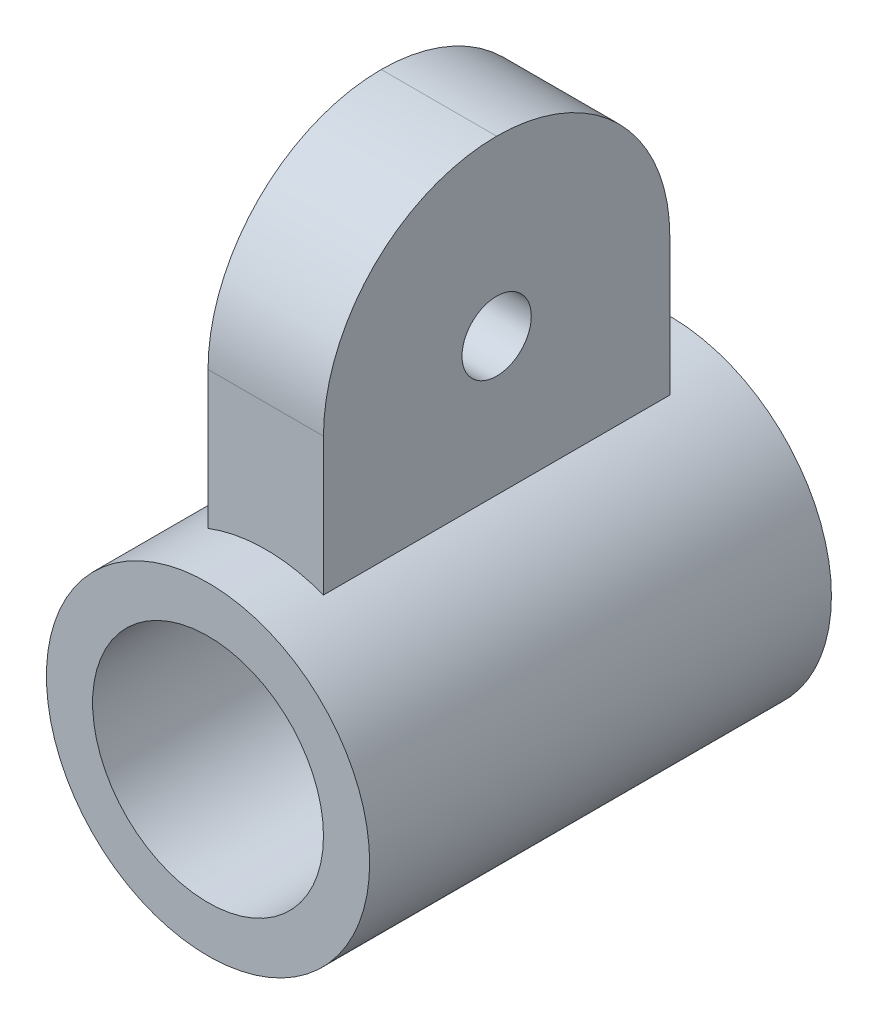
from build123d import *

# Parameters (mm, degrees)
SKETCH1_R                = 14
SKETCH1_R_2              = 10
BOSS_EXTRUDE1_DEPTH      = 20
BOSS_EXTRUDE2_REACH      = 61.262
BOSS_EXTRUDE2_END_RADIUS = 14
SKETCH4_W                = 10
SKETCH4_H                = 30
FILLET1_R                = 15
CUT_EXTRUDE1_REACH       = 50.59
SKETCH5_R                = 3


with BuildPart() as part:
    # Sketch1 → Boss-Extrude1 (new, symmetric)
    with BuildSketch(Plane.XY):
        Circle(SKETCH1_R)
        Circle(SKETCH1_R_2, mode=Mode.SUBTRACT)
    extrude(amount=BOSS_EXTRUDE1_DEPTH, both=True)

    # Boss-Extrude2: up to this cylinder (the profile starts outside it)
    boss_extrude2_end = Plane(origin=(0, 0, 0), z_dir=(0, 0, -1)) * Cylinder(BOSS_EXTRUDE2_END_RADIUS, 151.524, mode=Mode.PRIVATE)
    # Sketch4 → Boss-Extrude2 (add, up to the surface)
    with BuildSketch(Plane(origin=(0, 40, 0), x_dir=(1, 0, 0), z_dir=(0, 1, 0)), mode=Mode.PRIVATE) as boss_extrude2_sk1:
        Rectangle(SKETCH4_W, SKETCH4_H)
    boss_extrude2_tool1 = extrude(boss_extrude2_sk1.sketch, amount=-BOSS_EXTRUDE2_REACH, mode=Mode.PRIVATE) - boss_extrude2_end
    add(boss_extrude2_tool1.solids().sort_by_distance((0, 40, 0))[0])

    # Fillet1
    fillet1_edges = [part.edges().sort_by_distance(p)[0] for p in [
        (0, 40, 15),
        (0, 40, -15),
    ]]
    fillet(fillet1_edges, radius=FILLET1_R - 0.0001)  # a hair under: the kernel refuses the full size

    # Sketch5 → Cut-Extrude1 (cut, up to next)
    with BuildSketch(Plane.ZY.offset(5), mode=Mode.PRIVATE) as cut_extrude1_sk1:
        with Locations((0, 25)):
            Circle(SKETCH5_R)
    cut_extrude1_tool1 = extrude(cut_extrude1_sk1.sketch, amount=-CUT_EXTRUDE1_REACH, mode=Mode.PRIVATE) & part.part
    add(cut_extrude1_tool1.solids().sort_by_distance((-5, 25, 0))[0], mode=Mode.SUBTRACT)


solid = part.part
